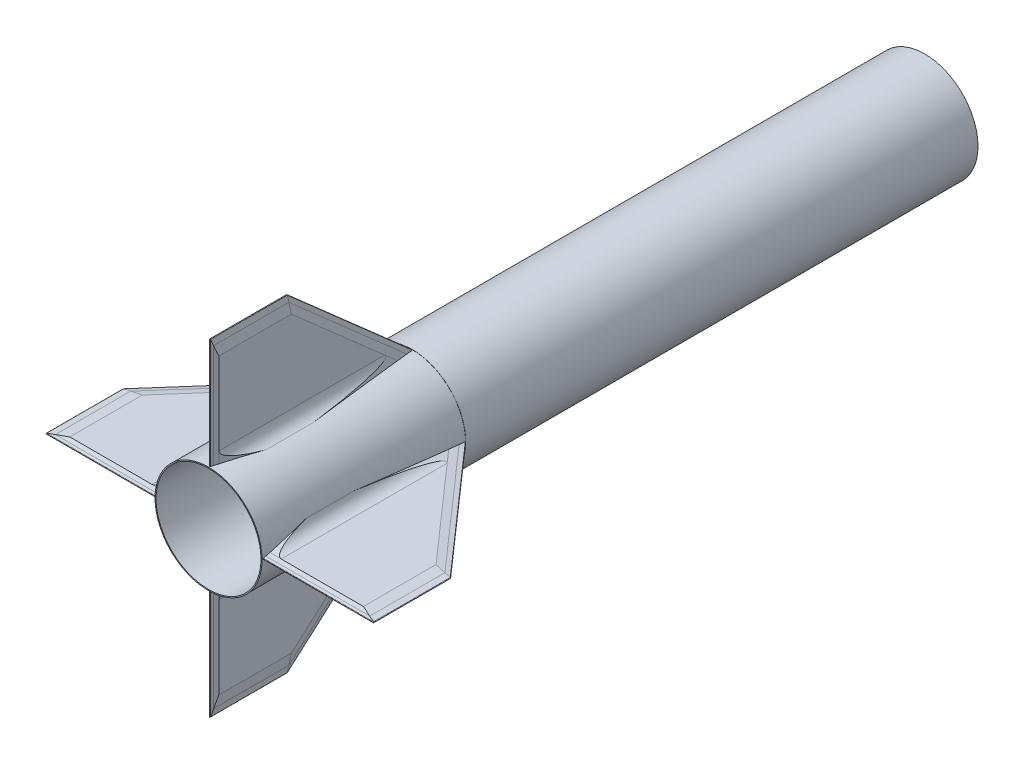
from build123d import *

# Parameters (mm, degrees)
FINBODY_DEPTH            = 3.175
CARBONFIBERX5_DEPTH      = 1.6002
CUT_EXTRUDE1_START       = 30.070082039
CUT_EXTRUDE1_OUTLINE_W   = 172
CUT_EXTRUDE1_OUTLINE_H   = 223
CUT_EXTRUDE1_DEPTH       = 3.929917961
CUT_EXTRUDE1_START_2     = 33.205646313
CUT_EXTRUDE1_2_OUTLINE_W = 172
CUT_EXTRUDE1_2_OUTLINE_H = 222
CUT_EXTRUDE1_2_DEPTH     = 3.794353687
CUT_EXTRUDE1_START_3     = -230
CUT_EXTRUDE1_3_DEPTH     = 340.7476603
CUT_EXTRUDE4_DEPTH       = 344.136185034
CUT_EXTRUDE4_DEPTH_BACK  = 344.136185034
CUT_EXTRUDE5_DEPTH       = 341.511591872
CUT_EXTRUDE5_DEPTH_BACK  = 341.511591872
SKETCH13_R               = 78.36
SKETCH13_R_2             = 77.09
BOSS_EXTRUDE1_DEPTH      = 914.4
BOSS_EXTRUDE2_REACH      = 934.109
BOSS_EXTRUDE3_START      = -56.951017769
BOSS_EXTRUDE3_DEPTH      = 70.189177625
BOSS_EXTRUDE3_START_2    = -274.544770627
BOSS_EXTRUDE3_2_DEPTH    = 262.648112268
BOSS_EXTRUDE3_START_3    = -88
BOSS_EXTRUDE3_3_DEPTH    = 101
CIRPATTERN1_COUNT        = 4
CIRPATTERN1_2_COUNT      = 4
CIRPATTERN1_3_COUNT      = 4
CIRPATTERN1_4_COUNT      = 4
CIRPATTERN1_5_COUNT      = 4
SKETCH18_W               = 519.548726742
SKETCH18_H               = 439.659397243
CUT_EXTRUDE6_DEPTH       = 615.0399
SKETCH17_R               = 78.614
SKETCH17_R_2             = 78.36
SKETCH17_R_3             = 77.09
BOSS_EXTRUDE4_DEPTH      = 0.1
SKETCH19_R               = 78.614
SKETCH19_R_2             = 77.09
BOSS_EXTRUDE5_DEPTH      = 0.1
SKETCH20_R               = 78.36
SKETCH20_R_2             = 77.09
BOSS_EXTRUDE6_DEPTH      = 914.4
SKETCH21_W               = 490.676006992
SKETCH21_H               = 455.150743556
CUT_EXTRUDE7_DEPTH       = 263.4
SKETCH22_R               = 78.36
SKETCH22_R_2             = 77.09
BOSS_EXTRUDE7_DEPTH      = 101.6


with BuildPart() as part:
    # Sketch1 → FinBody (new body)
    with BuildSketch(Plane(origin=(0, 0, 0), x_dir=(1, 0, 0), z_dir=(0, 1, 0))):
        Polygon((0, 0), (0, 304.8), (167.64, 114.3), (167.64, 0), align=None)
    extrude(amount=FINBODY_DEPTH)

    # Cut-Extrude1 3 outline → Cut-Extrude1 3 (cut)
    with BuildSketch(Plane(origin=(0, 0, 0), x_dir=(0.7507135169227551, 0, -0.660627894892025), z_dir=(0.660627894892025, 0, 0.7507135169227549)).offset(CUT_EXTRUDE1_START_3)):
        with BuildLine():
            Line((191.381223248, 3.175), (197.389983277, 2.219021404))
            add(Edge.make_bspline(
                [(197.389983277, 2.219021404), (197.765632434, 2.159256568), (197.765632434, 1.5875), (197.765632434, 1.015743432), (197.389983277, 0.955978596)],
                knots=[1.675516082, 1.675516082, 1.675516082, 3.141592654, 3.141592654, 4.607669225, 4.607669225, 4.607669225], degree=2, weights=[1, 0.743144825, 1, 0.743144825, 1]))
            Line((197.389983277, 0.955978596), (191.381223248, 0))
            Line((191.381223248, 0), (201.359382363, 0))
            Line((201.359382363, 0), (201.359382363, 3.175))
            Line((201.359382363, 3.175), (191.381223248, 3.175))
        make_face()
    extrude(amount=CUT_EXTRUDE1_3_DEPTH, mode=Mode.SUBTRACT)


with BuildPart() as body_2:
    # Sketch2 → CarbonFiberx5 (new body)
    with BuildSketch(Plane(origin=(0, 3.175, 0), x_dir=(1, 0, 0), z_dir=(0, 1, 0))):
        Polygon((0, 0), (167.64, 0), (167.64, 114.3), (0, 304.8), align=None)
    extrude(amount=CARBONFIBERX5_DEPTH)


with BuildPart() as body_3:
    # Mirror2: mirrored copy
    add(body_2.part.mirror(Plane.ZX.offset(1.5875)))

    # Cut-Extrude1: read off the stored shape, not the designer's step
    # Cut-Extrude1 outline → Cut-Extrude1 (cut)
    with BuildSketch(Plane(origin=(0, 0, 0), x_dir=(0.9930191618244789, 0.11730698463031215, 0.012329460910890686), z_dir=(0.11795314429640895, -0.9875792989546955, -0.10379876698083995)).offset(CUT_EXTRUDE1_START)):
        with Locations((81, -193.5)):
            Rectangle(CUT_EXTRUDE1_OUTLINE_W, CUT_EXTRUDE1_OUTLINE_H)
    extrude(amount=CUT_EXTRUDE1_DEPTH, mode=Mode.SUBTRACT)


with BuildPart() as body_2_1:
    add(body_2.part)

    # Cut-Extrude1 2 outline → Cut-Extrude1 2 (cut)
    with BuildSketch(Plane(origin=(0, 0, 0), x_dir=(0.9930191618244789, -0.11730698463031215, 0.012329460910890686), z_dir=(0.11795314429640895, 0.9875792989546955, -0.10379876698083995)).offset(CUT_EXTRUDE1_START_2)):
        with Locations((80, 193)):
            Rectangle(CUT_EXTRUDE1_2_OUTLINE_W, CUT_EXTRUDE1_2_OUTLINE_H)
    extrude(amount=CUT_EXTRUDE1_2_DEPTH, mode=Mode.SUBTRACT)


with BuildPart() as cut_extrude4_tool:
    # Sketch11 → Cut-Extrude4 (new, two sides: drawn at the far end of the back side and taken through both)
    with BuildSketch(Plane.XY.offset(-CUT_EXTRUDE4_DEPTH_BACK)):
        with BuildLine():
            Line((152.535946429, 3.175), (161.631475206, 2.219021404))
            ThreePointArc((161.631475206, 2.219021404), (162.200099632, 1.5875), (161.631475206, 0.955978596))
            Line((161.631475206, 0.955978596), (152.535946429, 0))
            Line((152.535946429, 0), (167.64, 0))
            Line((167.64, 0), (167.64, 3.175))
            Line((167.64, 3.175), (152.535946429, 3.175))
        make_face()
        Polygon((137.311060429, 4.7752), (152.535946429, 3.175), (167.64, 3.175), (167.64, 4.7752), align=None)
        Polygon((167.64, 0), (152.535946429, 0), (137.311060429, -1.6002), (167.64, -1.6002), align=None)
    extrude(amount=CUT_EXTRUDE4_DEPTH + CUT_EXTRUDE4_DEPTH_BACK)


with BuildPart() as part_1:
    add(part.part)

    # Cut-Extrude4: cut by cut_extrude4_tool
    add(cut_extrude4_tool.part, mode=Mode.SUBTRACT)


with BuildPart() as body_2_2:
    add(body_2_1.part)

    # Cut-Extrude4: cut by cut_extrude4_tool
    add(cut_extrude4_tool.part, mode=Mode.SUBTRACT)


with BuildPart() as body_3_1:
    add(body_3.part)

    # Cut-Extrude4: cut by cut_extrude4_tool
    add(cut_extrude4_tool.part, mode=Mode.SUBTRACT)


with BuildPart() as cut_extrude5_tool:
    # Sketch12 → Cut-Extrude5 (new, two sides: drawn at the far end of the back side and taken through both)
    with BuildSketch(Plane.ZY.offset(-CUT_EXTRUDE5_DEPTH_BACK)):
        with BuildLine():
            Line((-5.924630657, 3.175), (-2.289101505, 2.2008629))
            ThreePointArc((-2.289101505, 2.2008629), (-1.818451599, 1.5875), (-2.289101505, 0.9741371))
            Line((-2.289101505, 0.9741371), (-5.924630657, 0))
            Line((-5.924630657, 0), (0, 0))
            Line((0, 0), (0, 3.175))
            Line((0, 3.175), (-5.924630657, 3.175))
        make_face()
        Polygon((-11.896658359, 4.7752), (-5.924630657, 3.175), (0, 3.175), (0, 4.7752), align=None)
        Polygon((0, 0), (-5.924630657, 0), (-11.896658359, -1.6002), (0, -1.6002), align=None)
    extrude(amount=CUT_EXTRUDE5_DEPTH + CUT_EXTRUDE5_DEPTH_BACK)


with BuildPart() as part_2:
    add(part_1.part)

    # Cut-Extrude5: cut by cut_extrude5_tool
    add(cut_extrude5_tool.part, mode=Mode.SUBTRACT)



with BuildPart() as body_2_3:
    add(body_2_2.part)

    # Cut-Extrude5: cut by cut_extrude5_tool
    add(cut_extrude5_tool.part, mode=Mode.SUBTRACT)

    # CirPattern1 4: body 2 ×4 about axis
    cirpattern1_4_axis = Axis((-78.36, 1.5875, 0), (0, 0, 1))


with BuildPart() as body_3_2:
    add(body_3_1.part)

    # Cut-Extrude5: cut by cut_extrude5_tool
    add(cut_extrude5_tool.part, mode=Mode.SUBTRACT)

    # CirPattern1 2: body 3 ×4 about axis
    cirpattern1_2_axis = Axis((-78.36, 1.5875, 0), (0, 0, 1))


with BuildPart() as body_4:
    # Sketch13 → Boss-Extrude1 (new body)
    with BuildSketch(Plane.XY):
        with Locations((-78.36, 1.5875)):
            Circle(SKETCH13_R)
        with Locations((-78.36, 1.5875)):
            Circle(SKETCH13_R_2, mode=Mode.SUBTRACT)
    extrude(amount=-BOSS_EXTRUDE1_DEPTH)


with BuildPart() as part_3:
    add(part_2.part)

    # Boss-Extrude2: up to this face of the body
    boss_extrude2_end = body_4.part.faces().sort_by_distance((-156.72, 1.5875, -457.2))[0]
    # Sketch14 → Boss-Extrude2 (add, up to the picked face)
    with BuildSketch(Plane.ZY, mode=Mode.PRIVATE) as boss_extrude2_sk1:
        with BuildLine():
            ThreePointArc((-2.289101505, 0.9741371), (-1.818451599, 1.5875), (-2.289101505, 2.2008629))
            Line((-2.289101505, 2.2008629), (-5.924630657, 3.175))
            Line((-5.924630657, 3.175), (-289.695946429, 3.175))
            Line((-289.695946429, 3.175), (-298.791475206, 2.219021404))
            ThreePointArc((-298.791475206, 2.219021404), (-299.360099632, 1.5875), (-298.791475206, 0.955978596))
            Line((-298.791475206, 0.955978596), (-289.695946429, 0))
            Line((-289.695946429, 0), (-5.924630657, 0))
            Line((-5.924630657, 0), (-2.289101505, 0.9741371))
        make_face()
    boss_extrude2_tool1 = split(extrude(boss_extrude2_sk1.sketch, amount=BOSS_EXTRUDE2_REACH, mode=Mode.PRIVATE), bisect_by=boss_extrude2_end, keep=Keep.BOTH, mode=Mode.PRIVATE)
    # Sketch14 → Boss-Extrude2 (add, up to the picked face)
    with BuildSketch(Plane.ZY, mode=Mode.PRIVATE) as boss_extrude2_sk2:
        Polygon((-289.695946429, 3.175), (-5.924630657, 3.175), (-11.896658359, 4.7752), (-274.471060429, 4.7752), align=None)
    boss_extrude2_tool2 = split(extrude(boss_extrude2_sk2.sketch, amount=BOSS_EXTRUDE2_REACH, mode=Mode.PRIVATE), bisect_by=boss_extrude2_end, keep=Keep.BOTH, mode=Mode.PRIVATE)
    # Sketch14 → Boss-Extrude2 (add, up to the picked face)
    with BuildSketch(Plane.ZY, mode=Mode.PRIVATE) as boss_extrude2_sk3:
        Polygon((-11.896658359, -1.6002), (-5.924630657, 0), (-289.695946429, 0), (-274.471060429, -1.6002), align=None)
    boss_extrude2_tool3 = split(extrude(boss_extrude2_sk3.sketch, amount=BOSS_EXTRUDE2_REACH, mode=Mode.PRIVATE), bisect_by=boss_extrude2_end, keep=Keep.BOTH, mode=Mode.PRIVATE)
    add(boss_extrude2_tool1.solids().sort_by(Axis((0, 1.5875, -149.762129), (-1, 0, 0)))[0])
    add(boss_extrude2_tool1.solids().sort_by(Axis((0, 1.5875, -149.762129), (-1, 0, 0)))[1])
    add(boss_extrude2_tool2.solids().sort_by(Axis((0, 3.964753, -145.52699), (-1, 0, 0)))[0])
    add(boss_extrude2_tool3.solids().sort_by(Axis((0, -0.789753, -145.52699), (-1, 0, 0)))[0])

    # CirPattern1 3: part ×4 about axis
    cirpattern1_3_axis = Axis((-78.36, 1.5875, 0), (0, 0, 1))


with BuildPart() as body_5:
    # Boss-Extrude3: read off the stored shape, not the designer's step
    # Boss-Extrude3 outline → Boss-Extrude3 (new body)
    with BuildSketch(Plane.XY.offset(-80).offset(BOSS_EXTRUDE3_START)):
        with BuildLine():
            Line((-0.064864974, 4.7752), (16.477718228, 4.7752))
            ThreePointArc((16.477718228, 4.7752), (4.644384042, 8.896211353), (-2.069233135, 19.476281152))
            ThreePointArc((-2.069233135, 19.476281152), (-0.718318458, 12.173287045), (-0.064864974, 4.7752))
        make_face()
    extrude(amount=BOSS_EXTRUDE3_DEPTH)

    # Boss-Extrude3 2 outline → Boss-Extrude3 2 (add)
    with BuildSketch(Plane.XY.offset(BOSS_EXTRUDE3_START_2)):
        with BuildLine():
            Line((-0.064864974, 4.7752), (16.477718228, 4.7752))
            ThreePointArc((16.477718228, 4.7752), (4.644384042, 8.896211353), (-2.069233135, 19.476281152))
            ThreePointArc((-2.069233135, 19.476281152), (-0.718318458, 12.173287045), (-0.064864974, 4.7752))
        make_face()
    extrude(amount=BOSS_EXTRUDE3_2_DEPTH)

    # Boss-Extrude3 3 outline → Boss-Extrude3 3 (cut)
    with BuildSketch(Plane(origin=(0, 0, 0), x_dir=(0.07755232947375353, 0.9966790611369077, 0.024829121701067894), z_dir=(0.9492172233880417, -0.08143002573530268, 0.30390099330578807)).offset(BOSS_EXTRUDE3_START_3)):
        Polygon((4.458927845, -11.310361504), (17.593489909, -62.951705289), (20, -72.413415114), (20, -9), (3.871305906, -9), align=None)
        Polygon((20, -268), (20, -99.303590445), (-2.062394099, -261.451175711), (-2.953451108, -268), align=None)
    extrude(amount=BOSS_EXTRUDE3_3_DEPTH, mode=Mode.SUBTRACT)


with BuildPart() as body_6:
    # Mirror3: mirrored copy
    add(body_5.part.mirror(Plane.ZX.offset(1.5875)))

    # CirPattern1: body 6 ×4 about axis
    cirpattern1_axis = Axis((-78.36, 1.5875, 0), (0, 0, 1))


with BuildPart() as body_6_1:
    add(body_6.part)
    for i in range(1, CIRPATTERN1_COUNT):
        add(body_6.part.rotate(cirpattern1_axis, i * 360 / CIRPATTERN1_COUNT))


with BuildPart() as body_3_3:
    add(body_3_2.part)
    for i in range(1, CIRPATTERN1_2_COUNT):
        add(body_3_2.part.rotate(cirpattern1_2_axis, i * 360 / CIRPATTERN1_2_COUNT))


with BuildPart() as part_4:
    add(part_3.part)
    for i in range(1, CIRPATTERN1_3_COUNT):
        add(part_3.part.rotate(cirpattern1_3_axis, i * 360 / CIRPATTERN1_3_COUNT))


with BuildPart() as body_2_4:
    add(body_2_3.part)
    for i in range(1, CIRPATTERN1_4_COUNT):
        add(body_2_3.part.rotate(cirpattern1_4_axis, i * 360 / CIRPATTERN1_4_COUNT))


with BuildPart() as body_5_1:
    add(body_5.part)

    # CirPattern1 5: body 5 ×4 about axis
    cirpattern1_5_axis = Axis((-78.36, 1.5875, 0), (0, 0, 1))


with BuildPart() as body_5_2:
    add(body_5_1.part)
    for i in range(1, CIRPATTERN1_5_COUNT):
        add(body_5_1.part.rotate(cirpattern1_5_axis, i * 360 / CIRPATTERN1_5_COUNT))


with BuildPart() as body_4_1:
    add(body_4.part)

    # Sketch18 → Cut-Extrude6 (cut)
    with BuildSketch(Plane(origin=(0, 0, -914.4), x_dir=(-1, 0, 0), z_dir=(0, 0, -1))):
        with Locations((83.18552997, 2.793882493)):
            Rectangle(SKETCH18_W, SKETCH18_H)
    extrude(amount=-CUT_EXTRUDE6_DEPTH, mode=Mode.SUBTRACT)

    # Sketch17 → Boss-Extrude4 (add)
    # profile 1 of 2: a face of its own
    with BuildSketch(Plane.XY):
        with Locations((-78.36, 1.5875)):
            Circle(SKETCH17_R)
        with Locations((-78.36, 1.5875)):
            Circle(SKETCH17_R_2, mode=Mode.SUBTRACT)
    # profile 2 of 2: a face of its own
    with BuildSketch(Plane.XY):
        with Locations((-78.36, 1.5875)):
            Circle(SKETCH17_R_2)
        with Locations((-78.36, 1.5875)):
            Circle(SKETCH17_R_3, mode=Mode.SUBTRACT)
    extrude(amount=-BOSS_EXTRUDE4_DEPTH)

    # Sketch19 → Boss-Extrude5 (add)
    with BuildSketch(Plane(origin=(0, 0, -299.360099632), x_dir=(-1, 0, 0), z_dir=(0, 0, -1))):
        with Locations(Location((78.36, 1.5875, 0), (0, 0, 180))):
            Circle(SKETCH19_R)
        with Locations(Location((78.36, 1.5875, 0), (0, 0, 180))):
            Circle(SKETCH19_R_2, mode=Mode.SUBTRACT)
    extrude(amount=-BOSS_EXTRUDE5_DEPTH)

    # Sketch20 → Boss-Extrude6 (add)
    with BuildSketch(Plane(origin=(0, 0, -299.360099632), x_dir=(-1, 0, 0), z_dir=(0, 0, -1))):
        with Locations(Location((78.36, 1.5875, 0), (0, 0, 180))):
            Circle(SKETCH20_R)
        with Locations(Location((78.36, 1.5875, 0), (0, 0, 180))):
            Circle(SKETCH20_R_2, mode=Mode.SUBTRACT)
    extrude(amount=BOSS_EXTRUDE6_DEPTH)

    # Sketch21 → Cut-Extrude7 (cut)
    with BuildSketch(Plane(origin=(0, 0, -1213.760099632), x_dir=(-1, 0, 0), z_dir=(0, 0, -1))):
        with Locations((78.493553622, -8.429021645)):
            Rectangle(SKETCH21_W, SKETCH21_H)
    extrude(amount=-CUT_EXTRUDE7_DEPTH, mode=Mode.SUBTRACT)

    # Sketch22 → Boss-Extrude7 (add)
    with BuildSketch(Plane(origin=(0, 0, -950.360099632), x_dir=(-1, 0, 0), z_dir=(0, 0, -1))):
        with Locations(Location((78.36, 1.5875, 0), (0, 0, 180))):
            Circle(SKETCH22_R)
        with Locations(Location((78.36, 1.5875, 0), (0, 0, 180))):
            Circle(SKETCH22_R_2, mode=Mode.SUBTRACT)
    extrude(amount=BOSS_EXTRUDE7_DEPTH)


solid = Compound([body_6_1.part, body_3_3.part, part_4.part, body_2_4.part, body_5_2.part, body_4_1.part])
